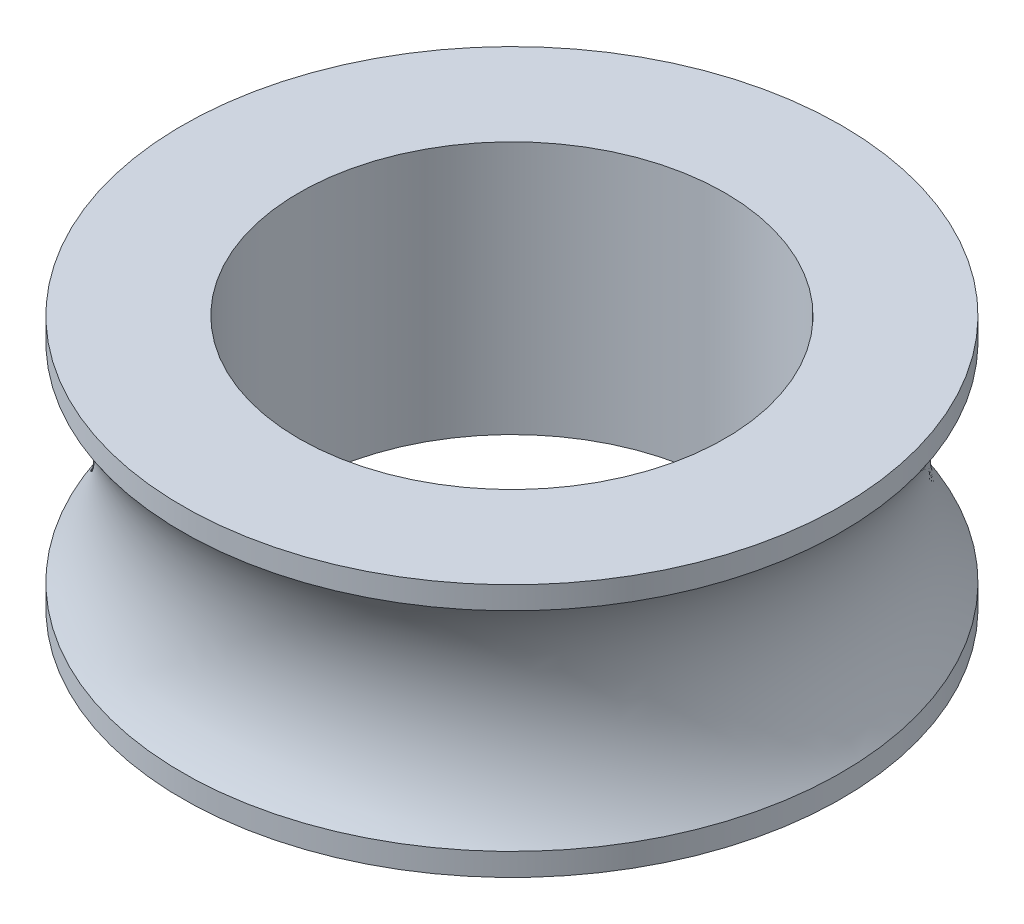
from build123d import *

# Parameters (mm, degrees)
SKETCH_2_R          = 25.2
CUT_EXTRUDE_1_DEPTH = 63.785348609


with BuildPart() as part:
    # 草图1 → 旋转1 (revolve)
    with BuildSketch(Plane.XY):
        with BuildLine():
            Line((39, 27.328828006), (39, 30))
            Line((39, 30), (0, 30))
            Line((0, 30), (0, 0))
            Line((0, 0), (39, 0))
            Line((39, 0), (39, 2.671171994))
            ThreePointArc((39, 2.671171994), (35, 15), (39, 27.328828006))
        make_face()
    revolve(axis=Axis((0, 0, 0), (0, 1, 0)))

    # 草图2 → 切除-拉伸1 (cut, through all)
    with BuildSketch(Plane(origin=(0, 30, 0), x_dir=(1, 0, 0), z_dir=(0, 1, 0))):
        Circle(SKETCH_2_R)
    extrude(amount=-CUT_EXTRUDE_1_DEPTH, mode=Mode.SUBTRACT)


solid = part.part
